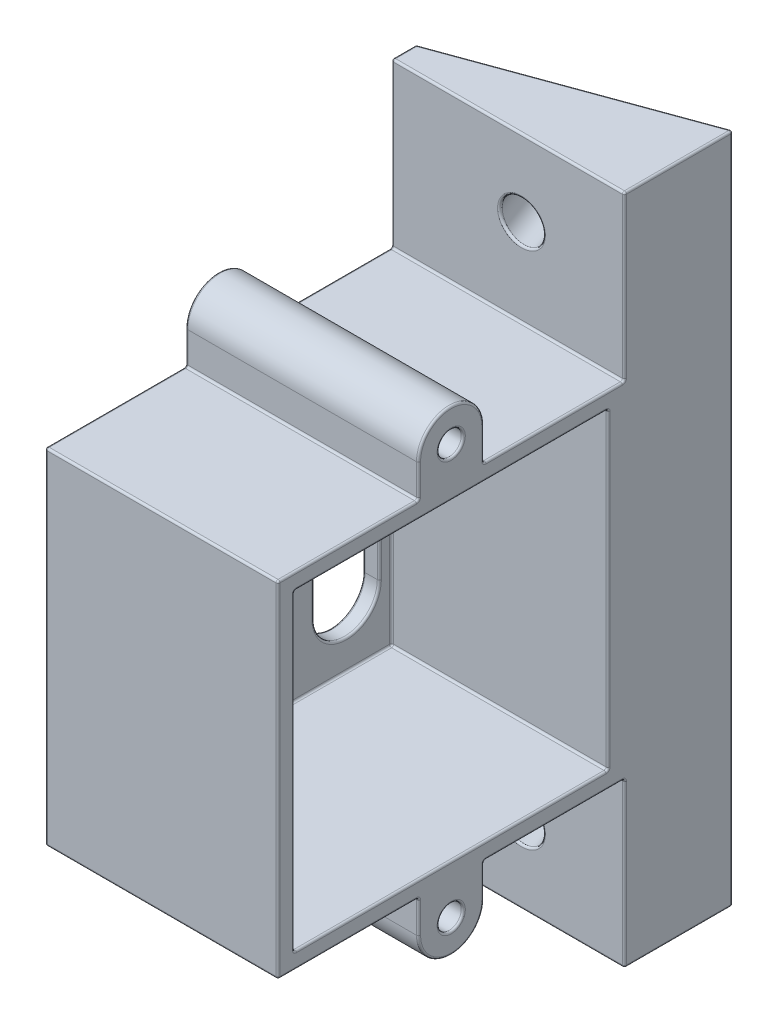
from build123d import *

# Parameters (mm, degrees)
SKETCH1_R                = 1.475
SKETCH1_W                = 38.2
SKETCH1_H                = 38.4
BOSS_EXTRUDE1_DEPTH      = 26.5
BOSS_EXTRUDE4_START      = 2
BOSS_EXTRUDE4_DEPTH      = 2
CUT_EXTRUDE1_DEPTH       = 2
BOSS_EXTRUDE7_DEPTH      = 20
BOSS_EXTRUDE7_DEPTH_BACK = 62.2
SKETCH10_R               = 2.5
CUT_EXTRUDE3_DEPTH       = 20
FILLET4_R                = 0.25


with BuildPart() as part:
    # Sketch1 → Boss-Extrude1 (new body)
    with BuildSketch(Plane.YZ):
        with BuildLine():
            Line((-21.1, 21.2), (21.1, 21.2))
            Line((21.1, 21.2), (21.1, 4))
            Line((21.1, 4), (25.1, 4))
            ThreePointArc((25.1, 4), (29.1, 0), (25.1, -4))
            Line((25.1, -4), (21.1, -4))
            Line((21.1, -4), (21.1, -21.2))
            Line((21.1, -21.2), (-21.1, -21.2))
            Line((-21.1, -21.2), (-21.1, -4))
            Line((-21.1, -4), (-25.1, -4))
            ThreePointArc((-25.1, -4), (-29.1, 0), (-25.1, 4))
            Line((-25.1, 4), (-21.1, 4))
            Line((-21.1, 4), (-21.1, 21.2))
        make_face()
        with Locations((-25.1, 0)):
            Circle(SKETCH1_R, mode=Mode.SUBTRACT)
        with Locations((25.1, 0)):
            Circle(SKETCH1_R, mode=Mode.SUBTRACT)
        Rectangle(SKETCH1_W, SKETCH1_H, mode=Mode.SUBTRACT)
    extrude(amount=BOSS_EXTRUDE1_DEPTH)

    # Sketch2 → Boss-Extrude4 (add)
    with BuildSketch(Plane(origin=(0, 0, 0), x_dir=(0, -1, 0), z_dir=(-1, 0, 0)).offset(BOSS_EXTRUDE4_START)):
        with BuildLine():
            Line((-21.1, 21.2), (21.1, 21.2))
            Line((21.1, 21.2), (21.1, 4))
            Line((21.1, 4), (25.1, 4))
            ThreePointArc((25.1, 4), (29.1, 0), (25.1, -4))
            Line((25.1, -4), (21.1, -4))
            Line((21.1, -4), (21.1, -21.2))
            Line((21.1, -21.2), (-21.1, -21.2))
            Line((-21.1, -21.2), (-21.1, -4))
            Line((-21.1, -4), (-25.1, -4))
            ThreePointArc((-25.1, -4), (-29.1, 0), (-25.1, 4))
            Line((-25.1, 4), (-21.1, 4))
            Line((-21.1, 4), (-21.1, 21.2))
        make_face()
    extrude(amount=-BOSS_EXTRUDE4_DEPTH)

    # Sketch3 → Cut-Extrude1 (cut)
    with BuildSketch(Plane(origin=(-2, 0, 0), x_dir=(0, -1, 0), z_dir=(-1, 0, 0))):
        with BuildLine():
            Line((-11.5, -9.7), (11.5, -9.7))
            ThreePointArc((11.5, -9.7), (15.5, -13.7), (11.5, -17.7))
            Line((11.5, -17.7), (-11.5, -17.7))
            ThreePointArc((-11.5, -17.7), (-15.5, -13.7), (-11.5, -9.7))
        make_face()
    extrude(amount=-CUT_EXTRUDE1_DEPTH, mode=Mode.SUBTRACT)

    # Sketch9 → Boss-Extrude7 (add, two sides: drawn at the far end of the back side and taken through both)
    with BuildSketch(Plane(origin=(0, 21.1, 0), x_dir=(-1, 0, 0), z_dir=(0, 1, 0)).offset(-BOSS_EXTRUDE7_DEPTH_BACK)):
        Polygon((2, -21.2), (2, -24.2), (-26.5, -34.573151677), (-26.5, -21.2), align=None)
    extrude(amount=BOSS_EXTRUDE7_DEPTH + BOSS_EXTRUDE7_DEPTH_BACK)

    # Sketch10 → Cut-Extrude3 (cut)
    with BuildSketch(Plane(origin=(-8.011685634, 0, -22.011925371), x_dir=(0.9396926207859083, 0, -0.3420201433256693), z_dir=(-0.3420201433256693, 0, -0.9396926207859083))):
        with Locations((20.397502227, 31.75)):
            Circle(SKETCH10_R)
        with Locations((20.397502227, -31.75)):
            Circle(SKETCH10_R)
    extrude(amount=-CUT_EXTRUDE3_DEPTH, mode=Mode.SUBTRACT)

    # Fillet4
    fillet4_edges = [part.edges().sort_by_distance(p)[0] for p in [
        (8.806465139, 31.75, -28.133231648),
        (8.806465139, -31.75, -28.133231648),
        (11.329955086, 31.749991473, -21.2),
        (11.329955086, -31.750008527, -21.2),
        (12.25, -41.1, -21.2),
        (26.5, -41.1, -27.886575838),
        (12.25, -41.1, -29.386575838),
        (-2, -41.1, -22.7),
        (12.25, 41.1, -21.2),
        (26.5, 41.1, -27.886575838),
        (12.25, 41.1, -29.386575838),
        (-2, 41.1, -22.7),
        (-2, -31.1, -21.2),
        (-2, 31.1, -21.2),
        (-2, 0, -24.2),
        (26.5, 0, -34.573151677),
        (26.5, -31.1, -21.2),
        (26.5, 31.1, -21.2),
        (-2, 15.5, -13.7),
        (-2, 0, -17.7),
        (-2, -15.5, -13.7),
        (-2, 0, -9.7),
        (0, 15.5, -13.7),
        (0, 0, -17.7),
        (0, -15.5, -13.7),
        (0, 0, -9.7),
        (-2, 21.1, 12.6),
        (-2, 23.1, 4),
        (-2, 29.1, 0),
        (-2, 23.1, -4),
        (-2, 21.1, -12.6),
        (-2, -21.1, -12.6),
        (-2, -23.1, -4),
        (-2, -29.1, 0),
        (-2, -23.1, 4),
        (-2, -21.1, 12.6),
        (-2, 0, 21.2),
        (0, 23.625, 0),
        (26.5, 23.625, 0),
        (0, -26.575, 0),
        (26.5, -26.575, 0),
        (0, 19.1, 0),
        (0, 0, 19.2),
        (0, -19.1, 0),
        (0, 0, -19.2),
        (26.5, 19.1, 0),
        (26.5, 0, 19.2),
        (26.5, -19.1, 0),
        (26.5, 0, -19.2),
        (13.25, 19.1, -19.2),
        (13.25, -19.1, -19.2),
        (13.25, -19.1, 19.2),
        (13.25, 19.1, 19.2),
        (26.5, 21.1, -12.6),
        (26.5, 23.1, -4),
        (26.5, 29.1, 0),
        (26.5, 23.1, 4),
        (26.5, 21.1, 12.6),
        (26.5, 0, 21.2),
        (26.5, -21.1, 12.6),
        (26.5, -23.1, 4),
        (26.5, -29.1, 0),
        (26.5, -23.1, -4),
        (26.5, -21.1, -12.6),
        (12.25, 21.1, -21.2),
        (12.25, -21.1, -21.2),
        (12.25, -21.1, -4),
        (12.25, -21.1, 4),
        (12.25, -21.1, 21.2),
        (12.25, 21.1, 21.2),
        (12.25, 21.1, 4),
        (12.25, 21.1, -4),
    ]]
    fillet(fillet4_edges, radius=FILLET4_R)


solid = part.part
